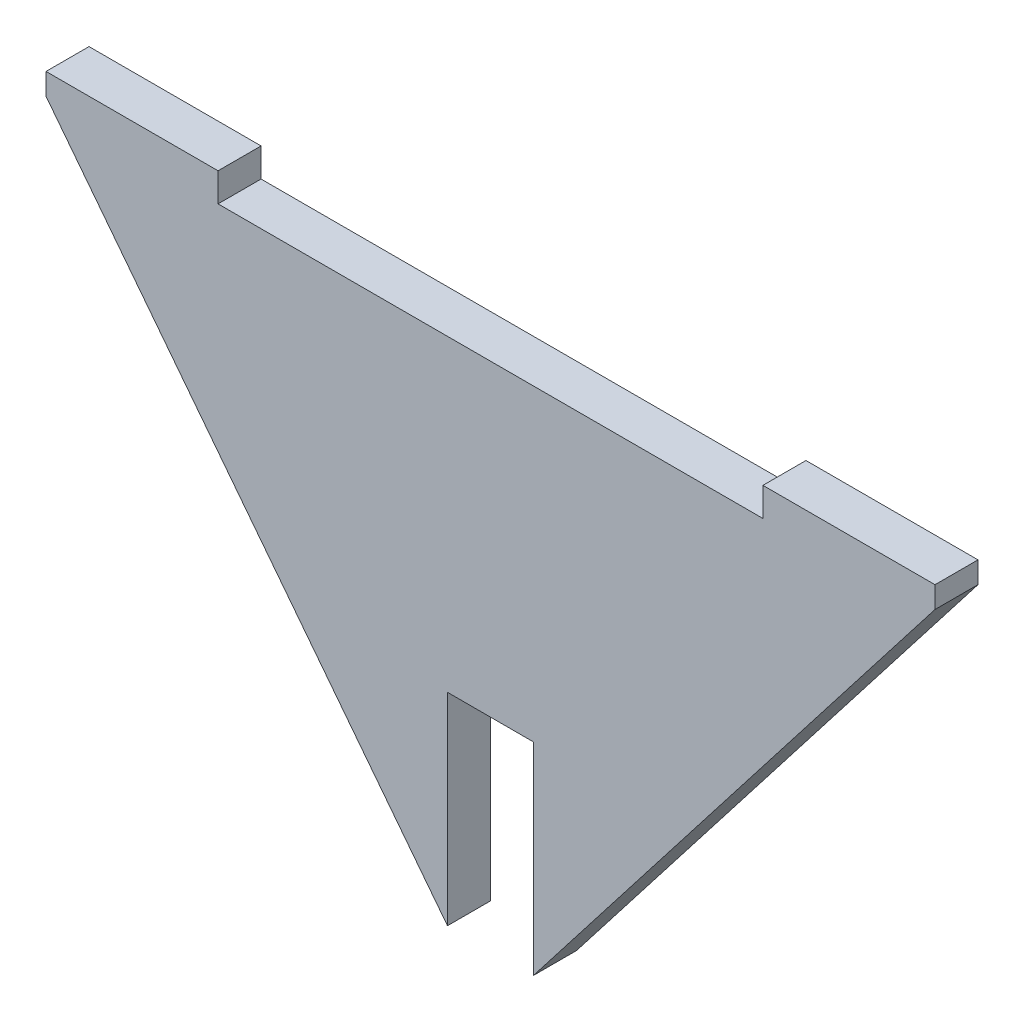
from build123d import *

# Parameters (mm, degrees)
BOSS_EXTRU_1_DEPTH = 3


with BuildPart() as part:
    # Esquisse1 → Boss.-Extru.1 (new body)
    with BuildSketch(Plane.XY):
        Polygon((-11.582805373, 14.707112971), (26.417194627, 14.707112971), (26.417194627, 16.707112971), (38.417194627, 16.707112971), (38.417194627, 15.207112971), (10.417194627, -20.892887029), (10.417194627, -6.792887029), (4.417194627, -6.792887029), (4.417194627, -20.892887029), (-23.582805373, 15.207112971), (-23.582805373, 16.707112971), (-11.582805373, 16.707112971), align=None)
    extrude(amount=BOSS_EXTRU_1_DEPTH)


solid = part.part
